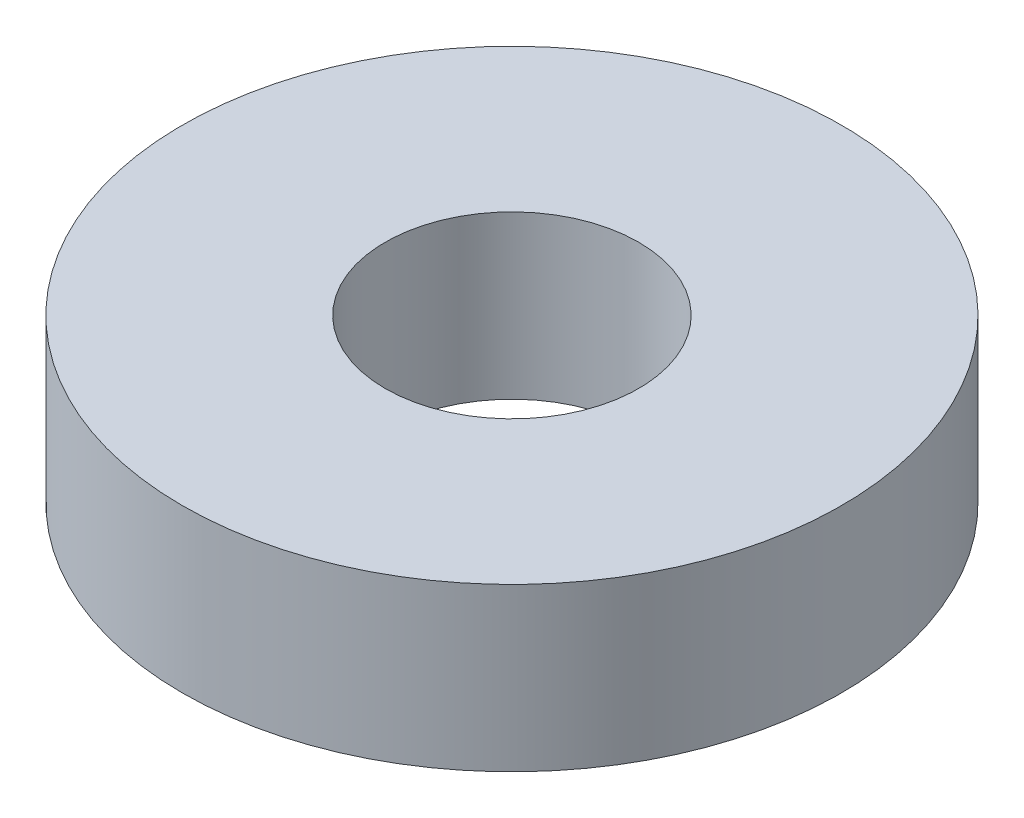
from build123d import *

# Parameters (mm, degrees)
SKETCH1_R           = 32.5
BOSS_EXTRUDE1_DEPTH = 16
SKETCH2_R           = 12.5
CUT_EXTRUDE1_DEPTH  = 49.66723744


with BuildPart() as part:
    # Sketch1 → Boss-Extrude1 (new body)
    with BuildSketch(Plane(origin=(0, 0, 0), x_dir=(1, 0, 0), z_dir=(0, 1, 0))):
        Circle(SKETCH1_R)
    extrude(amount=BOSS_EXTRUDE1_DEPTH)

    # Sketch2 → Cut-Extrude1 (cut, through all)
    with BuildSketch(Plane(origin=(0, 0, 0), x_dir=(1, 0, 0), z_dir=(0, 1, 0))):
        Circle(SKETCH2_R)
    extrude(amount=CUT_EXTRUDE1_DEPTH, mode=Mode.SUBTRACT)


solid = part.part
